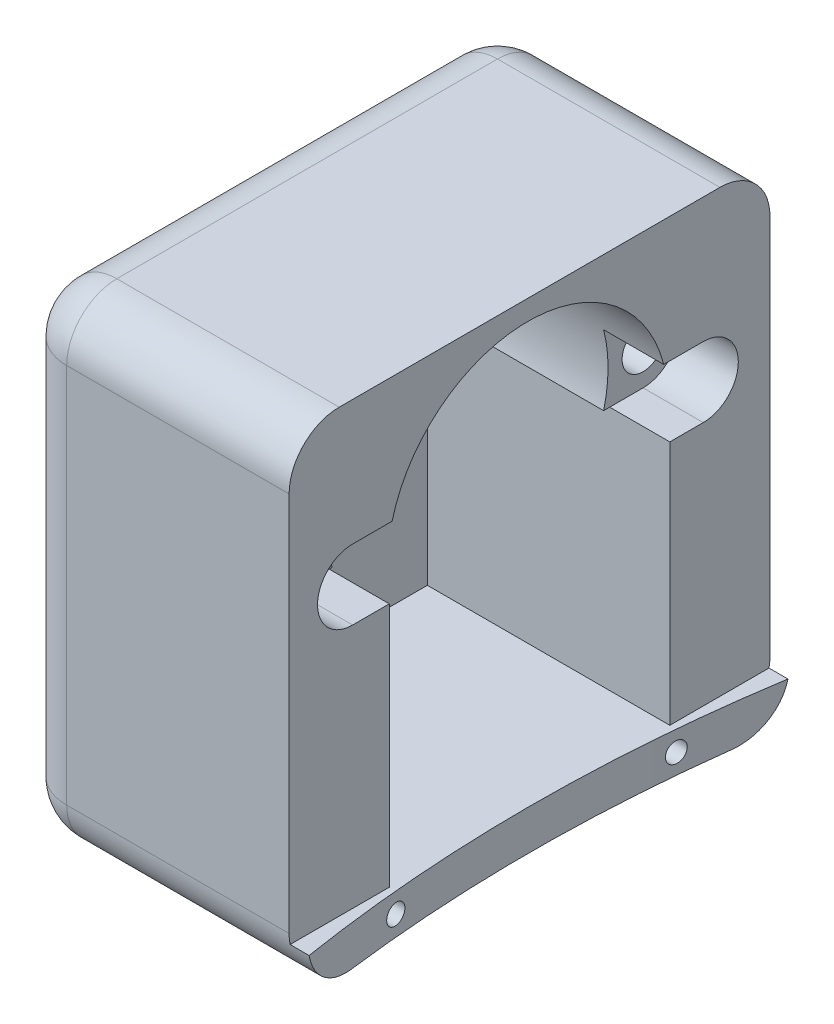
from build123d import *

# Parameters (mm, degrees)
ESQUISSE1_W             = 48
ESQUISSE1_H             = 48
BOSS_EXTRU_1_DEPTH      = 27.2
ESQUISSE1_5_R           = 3.120993446
ENL_V_MAT_EXTRU_1_DEPTH = 24.2
ESQUISSE1_6_R           = 2.1
ENL_V_MAT_EXTRU_2_DEPTH = 6
ESQUISSE1_8_R           = 2.1
ENL_V_MAT_EXTRU_3_DEPTH = 16
BOSS_EXTRU_3_DEPTH      = 4
ESQUISSE1_9_R           = 1
ENL_V_MAT_EXTRU_4_DEPTH = 10
ENL_V_START             = 10
ESQUISSE1_10_R          = 1
ENL_V_MAT_EXTRU_5_DEPTH = 10
CONG_1_R                = 5


with BuildPart() as part:
    # Esquisse1 → Boss.-Extru.1 (new body)
    with BuildSketch(Plane(origin=(0, 0, 0), x_dir=(0, 0, -1), z_dir=(1, 0, 0))):
        with Locations((0, -1)):
            Rectangle(ESQUISSE1_W, ESQUISSE1_H)
    extrude(amount=-BOSS_EXTRU_1_DEPTH)

    # Esquisse1<5> → Enlèv. mat.-Extru.1 (cut)
    # profile 1 of 4: a face of its own
    with BuildSketch(Plane(origin=(0, 0, 0), x_dir=(0, 0, -1), z_dir=(1, 0, 0))):
        with BuildLine():
            ThreePointArc((-14.162038672, 7), (-14.05045442, 5.235939905), (-13.717480384, 3.5))
            ThreePointArc((-13.717480384, 3.5), (-0.162038672, -7), (13.39340304, 3.5))
            ThreePointArc((13.39340304, 3.5), (13.726377076, 5.235939905), (13.837961328, 7))
            Line((13.837961328, 7), (-14.162038672, 7))
        make_face()
    # profile 2 of 4: a face of its own
    with BuildSketch(Plane(origin=(0, 0, 0), x_dir=(0, 0, -1), z_dir=(1, 0, 0))):
        with BuildLine():
            ThreePointArc((13.39340304, 10.5), (8.411175453, 18.067971791), (-0.162038609, 21))
            ThreePointArc((-0.162038609, 21), (-8.735252747, 18.06797183), (-13.717480384, 10.5))
            ThreePointArc((-13.717480384, 10.5), (-14.05045442, 8.764060095), (-14.162038672, 7))
            Line((-14.162038672, 7), (13.837961328, 7))
            ThreePointArc((13.837961328, 7), (13.726377076, 8.764060095), (13.39340304, 10.5))
        make_face()
        with Locations((0, 15)):
            Circle(ESQUISSE1_5_R, mode=Mode.SUBTRACT)
    # profile 3 of 4: a face of its own
    with BuildSketch(Plane(origin=(0, 0, 0), x_dir=(0, 0, -1), z_dir=(1, 0, 0))):
        with BuildLine():
            Line((-14, 3.5), (-14, -21))
            Line((-14, -21), (14, -21))
            Line((14, -21), (14, 3.5))
            Line((14, 3.5), (13.39340304, 3.5))
            ThreePointArc((13.39340304, 3.5), (-0.162038672, -7), (-13.717480384, 3.5))
            Line((-13.717480384, 3.5), (-14, 3.5))
        make_face()
    # profile 4 of 4: a face of its own
    with BuildSketch(Plane(origin=(0, 0, 0), x_dir=(0, 0, -1), z_dir=(1, 0, 0))):
        with Locations((0, 15)):
            Circle(ESQUISSE1_5_R)
    extrude(amount=-ENL_V_MAT_EXTRU_1_DEPTH, mode=Mode.SUBTRACT)

    # Esquisse1<6> → Enlèv. mat.-Extru.2 (cut)
    # profile 1 of 4: a face of its own
    with BuildSketch(Plane(origin=(0, 0, 0), x_dir=(0, 0, -1), z_dir=(1, 0, 0))):
        with BuildLine():
            Line((-17.662038672, 3.5), (-14, 3.5))
            Line((-14, 3.5), (-13.717480384, 3.5))
            ThreePointArc((-13.717480384, 3.5), (-14.05045442, 5.235939905), (-14.162038672, 7))
            ThreePointArc((-14.162038672, 7), (-14.05045442, 8.764060095), (-13.717480384, 10.5))
            Line((-13.717480384, 10.5), (-17.662038672, 10.5))
            ThreePointArc((-17.662038672, 10.5), (-21.162038672, 7), (-17.662038672, 3.5))
        make_face()
        with Locations((-17.662038672, 7)):
            Circle(ESQUISSE1_6_R, mode=Mode.SUBTRACT)
    # profile 2 of 4: a face of its own
    with BuildSketch(Plane(origin=(0, 0, 0), x_dir=(0, 0, -1), z_dir=(1, 0, 0))):
        with Locations((-17.662038672, 7)):
            Circle(ESQUISSE1_6_R)
    # profile 3 of 4: a face of its own
    with BuildSketch(Plane(origin=(0, 0, 0), x_dir=(0, 0, -1), z_dir=(1, 0, 0))):
        with BuildLine():
            Line((13.39340304, 3.5), (14, 3.5))
            Line((14, 3.5), (17.337961328, 3.5))
            ThreePointArc((17.337961328, 3.5), (20.837961328, 7), (17.337961328, 10.5))
            Line((17.337961328, 10.5), (13.39340304, 10.5))
            ThreePointArc((13.39340304, 10.5), (13.726377076, 8.764060095), (13.837961328, 7))
            ThreePointArc((13.837961328, 7), (13.726377076, 5.235939905), (13.39340304, 3.5))
        make_face()
        with Locations((17.337961328, 7)):
            Circle(ESQUISSE1_6_R, mode=Mode.SUBTRACT)
    # profile 4 of 4: a face of its own
    with BuildSketch(Plane(origin=(0, 0, 0), x_dir=(0, 0, -1), z_dir=(1, 0, 0))):
        with Locations((17.337961328, 7)):
            Circle(ESQUISSE1_6_R)
    extrude(amount=-ENL_V_MAT_EXTRU_2_DEPTH, mode=Mode.SUBTRACT)

    # Esquisse1<8> → Enlèv. mat.-Extru.3 (cut)
    with BuildSketch(Plane(origin=(0, 0, 0), x_dir=(0, 0, -1), z_dir=(1, 0, 0))):
        with Locations((-17.662038672, 7)):
            Circle(ESQUISSE1_8_R)
        with Locations((17.337961328, 7)):
            Circle(ESQUISSE1_8_R)
    extrude(amount=-ENL_V_MAT_EXTRU_3_DEPTH, mode=Mode.SUBTRACT)

    # Esquisse2 → Boss.-Extru.3 (add)
    with BuildSketch(Plane.XZ.offset(25)):
        with BuildLine():
            Line((0, 24), (1.906695686, 24))
            ThreePointArc((1.906695686, 24), (0, 0), (1.906695686, -24))
            Line((1.906695686, -24), (0, -24))
            Line((0, -24), (-1.50393066, -24))
            Line((-1.50393066, -24), (-1.50393066, 24))
            Line((-1.50393066, 24), (0, 24))
        make_face()
    extrude(amount=-BOSS_EXTRU_3_DEPTH)

    # Esquisse1<9> → Enlèv. mat.-Extru.4 (cut)
    with BuildSketch(Plane(origin=(0, 0, 0), x_dir=(0, 0, -1), z_dir=(1, 0, 0))):
        with Locations((-14, -23)):
            Circle(ESQUISSE1_9_R)
        with Locations((14, -23)):
            Circle(ESQUISSE1_9_R)
    extrude(amount=-ENL_V_MAT_EXTRU_4_DEPTH, mode=Mode.SUBTRACT)

    # Esquisse1<10> → Enlèv. mat.-Extru.5 (cut)
    with BuildSketch(Plane(origin=(0, 0, 0), x_dir=(0, 0, -1), z_dir=(1, 0, 0)).offset(ENL_V_START)):
        with Locations((-14, -23)):
            Circle(ESQUISSE1_10_R)
        with Locations((14, -23)):
            Circle(ESQUISSE1_10_R)
    extrude(amount=-ENL_V_MAT_EXTRU_5_DEPTH, mode=Mode.SUBTRACT)

    # Congé1
    # the kernel refuses this fillet: 5 mm, written as the material it takes off along each edge
    with BuildSketch(Plane(origin=(-22.2, -20, 19), x_dir=(0, -1, 0), z_dir=(-1, 0, 0))) as cong_1_piece_1_section:
        Polygon((0, 0), (CONG_1_R, 0), (CONG_1_R, CONG_1_R), (0, CONG_1_R), align=None)
    cong_1_piece_1 = extrude(amount=CONG_1_R, mode=Mode.PRIVATE)
    cong_1_piece_1 = cong_1_piece_1 - Plane(origin=(-22.2, -20, 19), x_dir=(0, 0.7071067811865477, -0.7071067811865475), z_dir=(-1, 0, 0)) * Sphere(CONG_1_R, mode=Mode.PRIVATE)
    add(cong_1_piece_1, mode=Mode.SUBTRACT)
    with BuildSketch(Plane(origin=(-22.2, -20, -19), x_dir=(0, -1, 0), z_dir=(-1, 0, 0))) as cong_1_piece_2_section:
        Polygon((0, 0), (CONG_1_R, 0), (CONG_1_R, -CONG_1_R), (0, -CONG_1_R), align=None)
    cong_1_piece_2 = extrude(amount=CONG_1_R, mode=Mode.PRIVATE)
    cong_1_piece_2 = cong_1_piece_2 - Plane(origin=(-22.2, -20, -19), x_dir=(0, 0.7071067811865475, 0.7071067811865476), z_dir=(-1, 0, 0)) * Sphere(CONG_1_R, mode=Mode.PRIVATE)
    add(cong_1_piece_2, mode=Mode.SUBTRACT)
    with BuildSketch(Plane(origin=(-22.2, 18, -19), x_dir=(-1, 0, 0), z_dir=(0, 1, 0))) as cong_1_piece_3_section:
        Polygon((0, 0), (CONG_1_R, 0), (CONG_1_R, -CONG_1_R), (0, -CONG_1_R), align=None)
    cong_1_piece_3 = extrude(amount=CONG_1_R, mode=Mode.PRIVATE)
    cong_1_piece_3 = cong_1_piece_3 - Plane(origin=(-22.2, 18, -19), x_dir=(0.7071067811865475, 0, 0.7071067811865475), z_dir=(0, 1, 0)) * Sphere(CONG_1_R, mode=Mode.PRIVATE)
    add(cong_1_piece_3, mode=Mode.SUBTRACT)
    with BuildSketch(Plane(origin=(-22.2, 18, 19), x_dir=(-1, 0, 0), z_dir=(0, 1, 0))) as cong_1_piece_4_section:
        Polygon((0, 0), (CONG_1_R, 0), (CONG_1_R, CONG_1_R), (0, CONG_1_R), align=None)
    cong_1_piece_4 = extrude(amount=CONG_1_R, mode=Mode.PRIVATE)
    cong_1_piece_4 = cong_1_piece_4 - Plane(origin=(-22.2, 18, 19), x_dir=(0.7071067811865475, 0, -0.7071067811865475), z_dir=(0, 1, 0)) * Sphere(CONG_1_R, mode=Mode.PRIVATE)
    add(cong_1_piece_4, mode=Mode.SUBTRACT)
    with BuildSketch(Plane(origin=(-22.2, -25, 24), x_dir=(0, 0, -1), z_dir=(1, 0, 0)), Plane(origin=(14.406695686, -25, -24), x_dir=(0, 0, 1), z_dir=(-1, 0, 0))) as cong_1_piece_5:
        with BuildLine():
            CenterArc((CONG_1_R, CONG_1_R), CONG_1_R, 180, 90)
            Line((0, CONG_1_R), (0, 0))
            Line((0, 0), (CONG_1_R, 0))
        make_face()
    extrude(amount=36.606695686, mode=Mode.SUBTRACT)
    with BuildSketch(Plane(origin=(-27.2, -25, -19), x_dir=(0, 1, 0), z_dir=(0, 0, 1)), Plane(origin=(-27.2, 18, -24), x_dir=(0, 0, 1), z_dir=(0, -1, 0)), Plane(origin=(-27.2, -20, 24), x_dir=(0, 0, -1), z_dir=(0, 1, 0))) as cong_1_piece_6:
        with BuildLine():
            CenterArc((CONG_1_R, -CONG_1_R), CONG_1_R, 90, 90)
            Line((0, -CONG_1_R), (0, 0))
            Line((0, 0), (CONG_1_R, 0))
        make_face()
    extrude(amount=38, mode=Mode.SUBTRACT)
    with BuildSketch(Plane(origin=(12.5, 23, -24), x_dir=(0, 0, 1), z_dir=(-1, 0, 0))) as cong_1_piece_7:
        with BuildLine():
            CenterArc((CONG_1_R, -CONG_1_R), CONG_1_R, 90, 90)
            Line((0, -CONG_1_R), (0, 0))
            Line((0, 0), (CONG_1_R, 0))
        make_face()
    extrude(amount=34.7, mode=Mode.SUBTRACT)
    with BuildSketch(Plane(origin=(-27.2, 23, 19), x_dir=(1, 0, 0), z_dir=(0, 0, -1))) as cong_1_piece_8:
        with BuildLine():
            CenterArc((CONG_1_R, CONG_1_R), CONG_1_R, 180, 90)
            Line((0, CONG_1_R), (0, 0))
            Line((0, 0), (CONG_1_R, 0))
        make_face()
    extrude(amount=38, mode=Mode.SUBTRACT)
    with BuildSketch(Plane(origin=(12.5, 23, 24), x_dir=(0, 0, -1), z_dir=(-1, 0, 0))) as cong_1_piece_9:
        with BuildLine():
            CenterArc((CONG_1_R, CONG_1_R), CONG_1_R, 180, 90)
            Line((0, CONG_1_R), (0, 0))
            Line((0, 0), (CONG_1_R, 0))
        make_face()
    extrude(amount=34.7, mode=Mode.SUBTRACT)


solid = part.part
